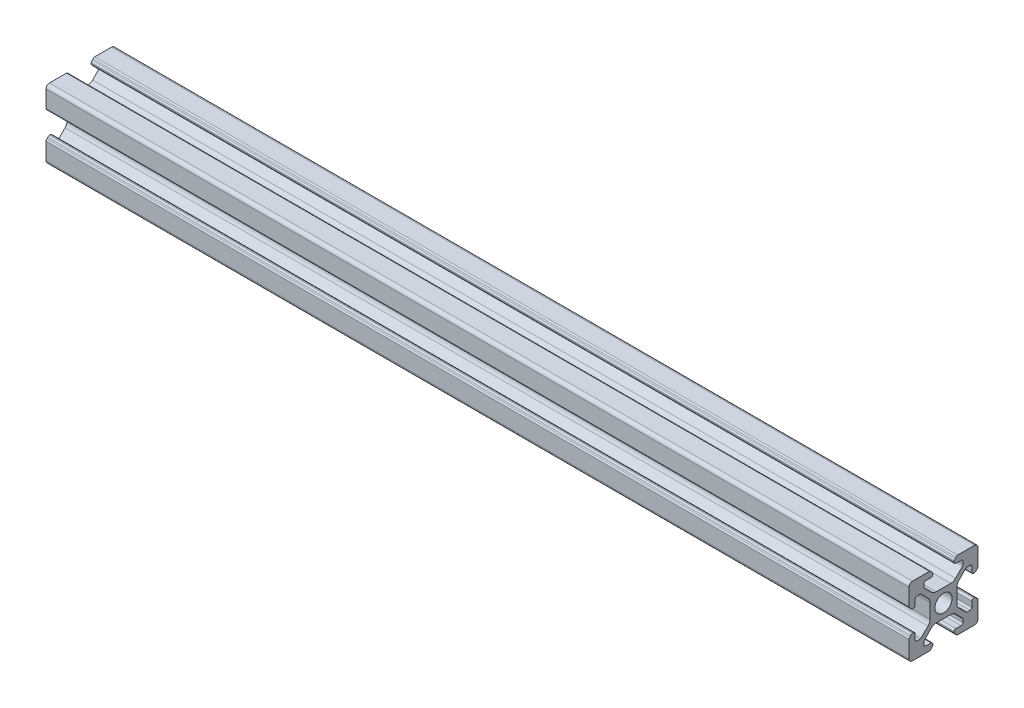
from build123d import *

# Parameters (mm, degrees)
SKETCH1_W                = 20
SKETCH1_H                = 20
BOSS_EXTRUDE1_DEPTH      = 250
FILLET1_R                = 1
CUT_EXTRUDE1_DEPTH       = 251.399680511
F_5_0_5_DIAMETER_HOLE1_D = 5
FILLET2_R                = 2
FILLET3_R                = 0.5
FILLET4_R                = 0.5
FILLET5_R                = 0.5


with BuildPart() as part:
    # Sketch1 → Boss-Extrude1 (new body)
    with BuildSketch(Plane(origin=(0, 0, 0), x_dir=(0, 0, -1), z_dir=(1, 0, 0))):
        Rectangle(SKETCH1_W, SKETCH1_H)
    extrude(amount=BOSS_EXTRUDE1_DEPTH)

    # Fillet1
    fillet1_edges = [part.edges().sort_by_distance(p)[0] for p in [
        (125, 10, 10),
        (125, 10, -10),
        (125, -10, -10),
        (125, -10, 10),
    ]]
    fillet(fillet1_edges, radius=FILLET1_R)

    # Sketch3 → Cut-Extrude1 (cut, through all)
    with BuildSketch(Plane.ZY):
        Polygon((-3.6, 10), (3.6, 10), (3.6, 9.5), (3.1, 9.5), (3.1, 8.2), (5.63, 8.2), (5.63, 6.619949494), (2.910050506, 3.9), (-2.910050506, 3.9), (-5.63, 6.619949494), (-5.63, 8.2), (-3.1, 8.2), (-3.1, 9.5), (-3.6, 9.5), align=None)
        Polygon((10, 3.6), (10, -3.6), (9.5, -3.6), (9.5, -3.1), (8.2, -3.1), (8.2, -5.63), (6.619949494, -5.63), (3.9, -2.910050506), (3.9, 2.910050506), (6.619949494, 5.63), (8.2, 5.63), (8.2, 3.1), (9.5, 3.1), (9.5, 3.6), align=None)
        Polygon((3.6, -10), (-3.6, -10), (-3.6, -9.5), (-3.1, -9.5), (-3.1, -8.2), (-5.63, -8.2), (-5.63, -6.619949494), (-2.910050506, -3.9), (2.910050506, -3.9), (5.63, -6.619949494), (5.63, -8.2), (3.1, -8.2), (3.1, -9.5), (3.6, -9.5), align=None)
        Polygon((-10, -3.6), (-10, 3.6), (-9.5, 3.6), (-9.5, 3.1), (-8.2, 3.1), (-8.2, 5.63), (-6.619949494, 5.63), (-3.9, 2.910050506), (-3.9, -2.910050506), (-6.619949494, -5.63), (-8.2, -5.63), (-8.2, -3.1), (-9.5, -3.1), (-9.5, -3.6), align=None)
    extrude(amount=-CUT_EXTRUDE1_DEPTH, mode=Mode.SUBTRACT)

    # Ø5.0 (5) Diameter Hole1 (through all)
    with Locations(Plane.ZY):
        with Locations((0, 0)):
            Hole(F_5_0_5_DIAMETER_HOLE1_D / 2)

    # Fillet2
    fillet2_edges = [part.edges().sort_by_distance(p)[0] for p in [
        (125, -3.9, -2.910050506),
        (125, -3.9, 2.910050506),
        (125, 2.910050506, -3.9),
        (125, -2.910050506, -3.9),
        (125, -2.910050506, 3.9),
        (125, 2.910050506, 3.9),
        (125, 3.9, 2.910050506),
        (125, 3.9, -2.910050506),
    ]]
    fillet(fillet2_edges, radius=FILLET2_R)

    # Fillet3
    fillet3_edges = [part.edges().sort_by_distance(p)[0] for p in [
        (125, 3.6, -10),
        (125, 3.1, -9.5),
        (125, 3.1, -8.2),
        (125, 5.63, -8.2),
        (125, 5.63, -6.619949494),
        (125, 3.6, 10),
        (125, 3.1, 9.5),
        (125, 3.1, 8.2),
        (125, 5.63, 8.2),
        (125, 5.63, 6.619949494),
        (125, 6.619949494, 5.63),
        (125, 8.2, 5.63),
        (125, 8.2, 3.1),
        (125, 9.5, 3.1),
        (125, 10, 3.6),
        (125, 9.5, -3.1),
        (125, 10, -3.6),
        (125, 8.2, -3.1),
        (125, 8.2, -5.63),
        (125, 6.619949494, -5.63),
    ]]
    fillet(fillet3_edges, radius=FILLET3_R - 0.0001)  # a hair under: the kernel refuses the full size

    # Fillet4
    fillet4_edges = [part.edges().sort_by_distance(p)[0] for p in [
        (125, -3.6, 10),
        (125, -3.1, 9.5),
        (125, -3.1, 8.2),
        (125, -5.63, 8.2),
        (125, -5.63, 6.619949494),
        (125, -6.619949494, 5.63),
        (125, -8.2, 5.63),
        (125, -8.2, 3.1),
        (125, -10, 3.6),
        (125, -9.5, 3.1),
        (125, -10, -3.6),
        (125, -9.5, -3.1),
        (125, -8.2, -3.1),
        (125, -8.2, -5.63),
        (125, -6.619949494, -5.63),
        (125, -5.63, -6.619949494),
        (125, -5.63, -8.2),
        (125, -3.1, -8.2),
        (125, -3.1, -9.5),
        (125, -3.6, -10),
    ]]
    fillet(fillet4_edges, radius=FILLET4_R - 0.0001)  # a hair under: the kernel refuses the full size

    # Fillet5
    fillet5_edges = [part.edges().sort_by_distance(p)[0] for p in [
        (125, 3.6, 9.5),
        (125, 9.5, 3.6),
        (125, 9.5, -3.6),
        (125, 3.6, -9.5),
        (125, -3.6, 9.5),
        (125, -9.5, 3.6),
        (125, -9.5, -3.6),
        (125, -3.6, -9.5),
    ]]
    fillet(fillet5_edges, radius=FILLET5_R)


solid = part.part
